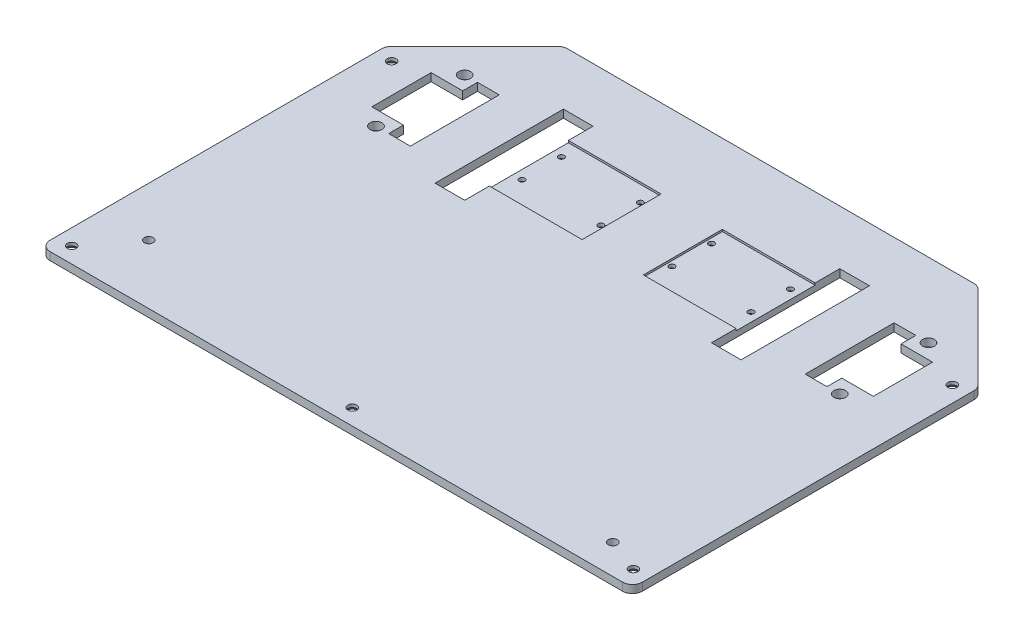
from build123d import *

# Parameters (mm, degrees)
MAIN_EXTRUSION_DEPTH                             = 4
CORNER_LEAVE_R                                   = 5
ESQUISSE2_R                                      = 3
ESQUISSE2_W                                      = 15
ESQUISSE2_H                                      = 65
ENL_V_MAT_EXTRU_1_DEPTH                          = 267.30058205
D_GAGEMENT_M41_D                                 = 4.5
ESQUISSE23_W                                     = 47
ESQUISSE23_H                                     = 40
ENL_V_MAT_EXTRU_2_DEPTH                          = 1
ESQUISSE24_R                                     = 1
ENL_V_MAT_EXTRU_3_DEPTH                          = 267.287438682
FRAISAGE_POUR_VIS_T_TE_FRAIS_E_M2_51_D           = 2.9
FRAISAGE_POUR_VIS_T_TE_FRAIS_E_M2_51_CSINK_D     = 5.5
FRAISAGE_POUR_VIS_T_TE_FRAIS_E_M2_51_CSINK_ANGLE = 90
FRAISAGE_POUR_VIS_T_TE_FRAIS_E_M41_AT_COUNT      = 2
FRAISAGE_POUR_VIS_T_TE_FRAIS_E_M41_AT_PITCH      = 142.035307944
FRAISAGE_POUR_VIS_T_TE_FRAIS_E_M41_2_COUNT       = 2
FRAISAGE_POUR_VIS_T_TE_FRAIS_E_M41_2_PITCH       = 284.035249862
FRAISAGE_POUR_VIS_T_TE_FRAIS_E_M41_3_COUNT       = 2
FRAISAGE_POUR_VIS_T_TE_FRAIS_E_M41_3_PITCH       = 326.770782266
FRAISAGE_POUR_VIS_T_TE_FRAIS_E_M41_4_COUNT       = 2
FRAISAGE_POUR_VIS_T_TE_FRAIS_E_M41_4_PITCH       = 161.565191978


with BuildPart() as part:
    # Main scetch → Main extrusion (new body)
    with BuildSketch(Plane(origin=(0, 0, 0), x_dir=(1, 0, 0), z_dir=(0, 1, 0))):
        Polygon((-150, 0), (150, 0), (150, 175), (105, 220), (-105, 220), (-150, 175), align=None)
    extrude(amount=MAIN_EXTRUSION_DEPTH)

    # Corner leave
    corner_leave_edges = [part.edges().sort_by_distance(p)[0] for p in [
        (-150, 2, 0),
        (150, 2, -175),
        (105, 2, -220),
        (150, 2, 0),
        (-105, 2, -220),
        (-150, 2, -175),
    ]]
    fillet(corner_leave_edges, radius=CORNER_LEAVE_R)

    # Esquisse2 → Enlèv. mat.-Extru.1 (cut, through all)
    with BuildSketch(Plane(origin=(0, 4, 0), x_dir=(1, 0, 0), z_dir=(0, 1, 0))):
        with Locations((117.47, 182.47)):
            Circle(ESQUISSE2_R)
        with Locations((117.47, 137.53)):
            Circle(ESQUISSE2_R)
        with Locations((-117.47, 137.53)):
            Circle(ESQUISSE2_R)
        with Locations((-117.47, 182.47)):
            Circle(ESQUISSE2_R)
        with Locations((70, 160)):
            Rectangle(ESQUISSE2_W, ESQUISSE2_H)
        Polygon((100, 137.5), (100, 182.5), (111, 182.5), (111, 175), (127, 175), (127, 145), (111, 145), (111, 137.5), align=None)
        Polygon((-111, 137.5), (-111, 145), (-127, 145), (-127, 175), (-111, 175), (-111, 182.5), (-100, 182.5), (-100, 137.5), align=None)
        with Locations((-70, 160)):
            Rectangle(ESQUISSE2_W, ESQUISSE2_H)
    extrude(amount=-ENL_V_MAT_EXTRU_1_DEPTH, mode=Mode.SUBTRACT)

    # Dégagement M41 (through all)
    with Locations(Plane(origin=(0, 4, 0), x_dir=(1, 0, 0), z_dir=(0, 1, 0))):
        with Locations((-125, 30), (125, 15)):
            Hole(D_GAGEMENT_M41_D / 2)

    # Esquisse23 → Enlèv. mat.-Extru.2 (cut)
    with BuildSketch(Plane(origin=(0, 4, 0), x_dir=(1, 0, 0), z_dir=(0, 1, 0))):
        with Locations((-39, 160)):
            Rectangle(ESQUISSE23_W, ESQUISSE23_H)
    enl_v_mat_extru_2 = extrude(amount=-ENL_V_MAT_EXTRU_2_DEPTH, mode=Mode.SUBTRACT)

    # Esquisse24 → Enlèv. mat.-Extru.3 (cut, through all)
    with BuildSketch(Plane(origin=(0, 3, 0), x_dir=(1, 0, 0), z_dir=(0, 1, 0))):
        with Locations((-58, 172)):
            Circle(ESQUISSE24_R)
        with Locations((-58, 152)):
            Circle(ESQUISSE24_R)
        with Locations((-18, 172)):
            Circle(ESQUISSE24_R)
        with Locations((-18, 152)):
            Circle(ESQUISSE24_R)
    enl_v_mat_extru_3 = extrude(amount=-ENL_V_MAT_EXTRU_3_DEPTH, mode=Mode.SUBTRACT)

    # Fraisage pour vis à tête fraisée M2.51 (through all)
    with Locations(Plane(origin=(0, 0, 0), x_dir=(-1, 0, 0), z_dir=(0, -1, 0))):
        with Locations((18, 172), (58, 172), (58, 152), (18, 152)):
            fraisage_pour_vis_t_te_frais_e_m2_51 = CounterSinkHole(FRAISAGE_POUR_VIS_T_TE_FRAIS_E_M2_51_D / 2, FRAISAGE_POUR_VIS_T_TE_FRAIS_E_M2_51_CSINK_D / 2, counter_sink_angle=FRAISAGE_POUR_VIS_T_TE_FRAIS_E_M2_51_CSINK_ANGLE)

    # Symétrie1: Enlèv. mat.-Extru.2, Enlèv. mat.-Extru.3, Fraisage pour vis à tête fraisée M2.51 across plane
    add(enl_v_mat_extru_2.mirror(Plane(origin=(0, 0, 0), x_dir=(0, 0, 1), z_dir=(1, 0, 0))), mode=Mode.SUBTRACT)
    add(enl_v_mat_extru_3.mirror(Plane(origin=(0, 0, 0), x_dir=(0, 0, 1), z_dir=(1, 0, 0))), mode=Mode.SUBTRACT)
    add(fraisage_pour_vis_t_te_frais_e_m2_51.mirror(Plane(origin=(0, 0, 0), x_dir=(0, 0, 1), z_dir=(1, 0, 0))), mode=Mode.SUBTRACT)

    # Esquisse31 → Fraisage pour vis à tête fraisée M41 (revolve, cut)
    with BuildSketch(Plane(origin=(142.034917049, 0, -8.434811795), x_dir=(0, 0, -1), z_dir=(1, 0, 0))):
        Polygon((0, 0), (0, 4), (2.25, 4), (2.25, 2.45), (4.7, 0), align=None)
    fraisage_pour_vis_t_te_frais_e_m41 = revolve(axis=Axis((142.034917049, -6.35, -8.434811795), (0, 1, 0)), mode=Mode.SUBTRACT)

    # Fraisage pour vis à tête fraisée M41 at: Fraisage pour vis à tête fraisée M41 ×2
    with Locations(*[Vector(-0.9999972478981508, 0, 0.002346102326084912) * (i * FRAISAGE_POUR_VIS_T_TE_FRAIS_E_M41_AT_PITCH) for i in range(1, FRAISAGE_POUR_VIS_T_TE_FRAIS_E_M41_AT_COUNT)]):
        add(fraisage_pour_vis_t_te_frais_e_m41, mode=Mode.SUBTRACT)

    # Fraisage pour vis _ t_te frais_e M41 2: Fraisage pour vis à tête fraisée M41 ×2
    with Locations(*[Vector(-0.9999988282676796, 0, 0.0015308374400840067) * (i * FRAISAGE_POUR_VIS_T_TE_FRAIS_E_M41_2_PITCH) for i in range(1, FRAISAGE_POUR_VIS_T_TE_FRAIS_E_M41_2_COUNT)]):
        add(fraisage_pour_vis_t_te_frais_e_m41, mode=Mode.SUBTRACT)

    # Fraisage pour vis _ t_te frais_e M41 3: Fraisage pour vis à tête fraisée M41 ×2
    with Locations(*[Vector(-0.8692176059291576, 0, -0.4944297255857335) * (i * FRAISAGE_POUR_VIS_T_TE_FRAIS_E_M41_3_PITCH) for i in range(1, FRAISAGE_POUR_VIS_T_TE_FRAIS_E_M41_3_COUNT)]):
        add(fraisage_pour_vis_t_te_frais_e_m41, mode=Mode.SUBTRACT)

    # Fraisage pour vis _ t_te frais_e M41 4: Fraisage pour vis à tête fraisée M41 ×2
    with Locations(*[Vector(-0.00021611739763843655, 0, -0.999999976646635) * (i * FRAISAGE_POUR_VIS_T_TE_FRAIS_E_M41_4_PITCH) for i in range(1, FRAISAGE_POUR_VIS_T_TE_FRAIS_E_M41_4_COUNT)]):
        add(fraisage_pour_vis_t_te_frais_e_m41, mode=Mode.SUBTRACT)


solid = part.part
